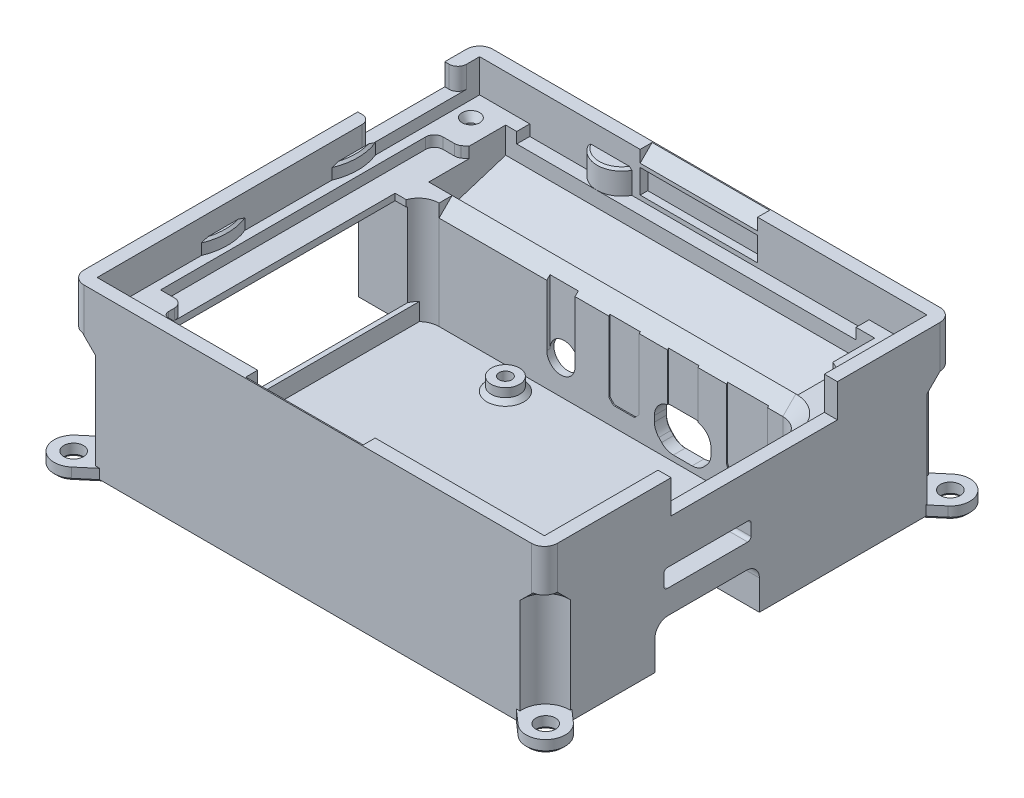
from build123d import *
from OCP.BRepFilletAPI import BRepFilletAPI_MakeChamfer

# Parameters (mm, degrees)
SKETCH1_W                          = 108.81
SKETCH1_H                          = 93.91
BOSS_EXTRUDE1_DEPTH                = 3
SKETCH2_W                          = 108.81
SKETCH2_H                          = 93.91
SKETCH2_W_2                        = 102.81
SKETCH2_H_2                        = 87.91
BOSS_EXTRUDE2_DEPTH                = 34.7
SKETCH3_W                          = 102.81
SKETCH3_H                          = 67.235
BOSS_EXTRUDE3_DEPTH                = 27.09
SKETCH4_R                          = 3.25
CUT_EXTRUDE1_DEPTH                 = 4.75
CUT_EXTRUDE2_DEPTH                 = 0.5
CUT_EXTRUDE2_DEPTH_BACK            = 1
SKETCH6_W                          = 9
SKETCH6_H                          = 20.675
BOSS_EXTRUDE4_DEPTH                = 27.09
SKETCH8_W                          = 84.81
SKETCH8_H                          = 20.675
BOSS_EXTRUDE5_DEPTH                = 6
SKETCH9_W                          = 84.81
SKETCH9_H                          = 24.09
CUT_EXTRUDE4_DEPTH                 = 23.675
SKETCH11_W                         = 18.87
SKETCH11_H                         = 15.3
SKETCH11_W_2                       = 18.86
SKETCH11_H_2                       = 15.1
CUT_EXTRUDE6_DEPTH                 = 81.489602124
SKETCH10_W                         = 57.35
SKETCH10_H                         = 26.1
CUT_EXTRUDE5_DEPTH                 = 13
CUT_EXTRUDE7_REACH                 = 96.383
CUT_EXTRUDE8_DEPTH                 = 1
CUT_EXTRUDE8_DEPTH_BACK            = 1
SKETCH12_3_R                       = 5.75
CUT_EXTRUDE9_DEPTH                 = 1.35
CHAMFER1_SIZE                      = 0.25
SKETCH14_W                         = 1.75
SKETCH14_H                         = 5
CUT_EXTRUDE10_DEPTH                = 13.5
SKETCH15_W                         = 38.225000066
SKETCH15_H                         = 7.61
CUT_EXTRUDE11_DEPTH                = 3
SKETCH16_W                         = 24.345
SKETCH16_H                         = 24
CUT_EXTRUDE12_DEPTH                = 10.6
SKETCH17_W                         = 20
SKETCH17_H                         = 4.16
CUT_EXTRUDE13_DEPTH                = 7.695
BOSS_EXTRUDE6_DEPTH                = 3
SKETCH19_R                         = 5.5
CUT_EXTRUDE14_DEPTH                = 25
F_8_CLEARANCE_HOLE1_D              = 4.4958
F_8_CLEARANCE_HOLE1_DEPTH          = 3
SKETCH49_R                         = 2
BOSS_EXTRUDE11_DEPTH               = 10
TAP_DRILL_FOR_M2_5X0_45_TAP1_D     = 2.05
TAP_DRILL_FOR_M2_5X0_45_TAP1_DEPTH = 10
TAP_DRILL_FOR_M2_5X0_45_TAP1_TIP   = 0.615882135
CHAMFER2_SIZE                      = 3
SKETCH28_W                         = 3
SKETCH28_H                         = 20
CUT_EXTRUDE16_DEPTH                = 5
FILLET1_R                          = 2
CUT_EXTRUDE17_DEPTH                = 2.15
SKETCH30_R                         = 3.25
BOSS_EXTRUDE7_DEPTH                = 3
M2_5_CLEARANCE_HOLE2_D             = 2.9
CUT_EXTRUDE20_DEPTH                = 2.5
SKETCH39_W                         = 2.54578851
SKETCH39_H                         = 52.15
CUT_EXTRUDE21_DEPTH                = 1.49
BOSS_EXTRUDE8_DEPTH                = 3
BOSS_EXTRUDE8_DIRECTION_2_REACH    = 86.122
CHAMFER3_SIZE                      = 0.5
CHAMFER4_SIZE                      = 3
SKETCH44_W                         = 5.21
SKETCH44_H                         = 62.918665607
CUT_EXTRUDE23_DEPTH                = 2.5
FILLET2_R                          = 2
FILLET3_R                          = 3
SKETCH45_W                         = 1.115
SKETCH45_H                         = 59.5
BOSS_EXTRUDE9_DEPTH                = 4
FILLET4_R                          = 3
CHAMFER8_SIZE                      = 1
FILLET5_R                          = 3
FILLET6_R                          = 0.75
CHAMFER6_SIZE                      = 0.75
CHAMFER10_SIZE                     = 0.5
CUT_EXTRUDE24_DEPTH                = 83.166846112
CUT_EXTRUDE24_DEPTH_BACK           = 83.166846112
SKETCH46_W                         = 84.81
SKETCH46_H                         = 17.675
BOSS_EXTRUDE10_DEPTH               = 84.81
CHAMFER11_SIZE                     = 1
CHAMFER11_SIZE2                    = 1.732050808
CHAMFER12_SIZE                     = 1
CHAMFER12_SIZE2                    = 1.732050808


with BuildPart() as part:
    # Sketch1 → Boss-Extrude1 (new body)
    with BuildSketch(Plane(origin=(0, -30.09, 0), x_dir=(-1, 0, 0), z_dir=(0, -1, 0))):
        with Locations((-1, 0)):
            Rectangle(SKETCH1_W, SKETCH1_H)
    extrude(amount=-BOSS_EXTRUDE1_DEPTH)

    # Sketch2 → Boss-Extrude2 (add)
    with BuildSketch(Plane(origin=(0, -27.09, 0), x_dir=(1, 0, 0), z_dir=(0, 1, 0))):
        with Locations((1, 0)):
            Rectangle(SKETCH2_W, SKETCH2_H)
        with Locations((1, 0)):
            Rectangle(SKETCH2_W_2, SKETCH2_H_2, mode=Mode.SUBTRACT)
    extrude(amount=BOSS_EXTRUDE2_DEPTH)

    # Sketch3 → Boss-Extrude3 (add)
    with BuildSketch(Plane(origin=(0, -27.09, 0), x_dir=(1, 0, 0), z_dir=(0, 1, 0))):
        with Locations((1, -10.3375)):
            Rectangle(SKETCH3_W, SKETCH3_H)
        with BuildLine():
            Line((47.71, -34.47), (47.71, 15.53))
            ThreePointArc((47.71, 15.53), (46.318757211, 18.888757211), (42.96, 20.28))
            Line((42.96, 20.28), (-36.04, 20.28))
            ThreePointArc((-36.04, 20.28), (-39.398757211, 18.888757211), (-40.79, 15.53))
            Line((-40.79, 15.53), (-40.79, -34.47))
            ThreePointArc((-40.79, -34.47), (-39.398757211, -37.828757211), (-36.04, -39.22))
            Line((-36.04, -39.22), (42.96, -39.22))
            ThreePointArc((42.96, -39.22), (46.318757211, -37.828757211), (47.71, -34.47))
        make_face(mode=Mode.SUBTRACT)
    extrude(amount=BOSS_EXTRUDE3_DEPTH)

    # Sketch4 → Cut-Extrude1 (cut)
    with BuildSketch(Plane(origin=(0, 0, -18.53), x_dir=(-1, 0, 0), z_dir=(0, 0, -1))):
        with Locations(Location((8.04, -19.49, 0), (0, 0, 180))):
            Circle(SKETCH4_R)
        with BuildLine():
            Line((-23.267993486, -21.841802043), (-22.623505714, -22.521604214))
            ThreePointArc((-22.623505714, -22.521604214), (-22.391987408, -22.683087455), (-22.115512228, -22.74))
            Line((-22.115512228, -22.74), (-20.120000109, -22.74))
            Line((-20.120000109, -22.74), (-19.800000109, -22.74))
            Line((-19.800000109, -22.74), (-17.804487772, -22.74))
            ThreePointArc((-17.804487772, -22.74), (-17.528012592, -22.683087455), (-17.296494286, -22.521604214))
            Line((-17.296494286, -22.521604214), (-16.652006514, -21.841802043))
            ThreePointArc((-16.652006514, -21.841802043), (-16.509771025, -21.619431855), (-16.46, -21.36019783))
            Line((-16.46, -21.36019783), (-16.46, -20.04))
            ThreePointArc((-16.46, -20.04), (-16.665025253, -19.545025253), (-17.16, -19.34))
            Line((-17.16, -19.34), (-22.76, -19.34))
            ThreePointArc((-22.76, -19.34), (-23.254974747, -19.545025253), (-23.46, -20.04))
            Line((-23.46, -20.04), (-23.46, -21.36019783))
            ThreePointArc((-23.46, -21.36019783), (-23.410228975, -21.619431855), (-23.267993486, -21.841802043))
        make_face()
    extrude(amount=CUT_EXTRUDE1_DEPTH, mode=Mode.SUBTRACT)

    # Sketch5 → Cut-Extrude2 (cut, two sides: drawn at the far end of the back side and taken through both)
    with BuildSketch(Plane(origin=(0, 0, -20.030000004), x_dir=(-1, 0, 0), z_dir=(0, 0, -1)).offset(-CUT_EXTRUDE2_DEPTH_BACK)):
        with BuildLine():
            Line((-39.48, -20.63), (-39.48, 0))
            Line((-39.48, 0), (-30.04, 0))
            Line((-30.04, 0), (-30.04, -20.63))
            Line((-30.04, -20.63), (-30.04, -21.19))
            ThreePointArc((-30.04, -21.19), (-30.493984489, -22.286015511), (-31.59, -22.74))
            Line((-31.59, -22.74), (-37.93, -22.74))
            ThreePointArc((-37.93, -22.74), (-39.026015511, -22.286015511), (-39.48, -21.19))
            Line((-39.48, -21.19), (-39.48, -20.63))
        make_face()
        with BuildLine():
            Line((-23.46, -20.04), (-23.46, 0))
            Line((-23.46, 0), (-16.46, 0))
            Line((-16.46, 0), (-16.46, -20.04))
            Line((-16.46, -20.04), (-16.46, -21.36019783))
            ThreePointArc((-16.46, -21.36019783), (-16.509771025, -21.619431855), (-16.652006514, -21.841802043))
            Line((-16.652006514, -21.841802043), (-17.296494286, -22.521604214))
            ThreePointArc((-17.296494286, -22.521604214), (-17.528012592, -22.683087455), (-17.804487772, -22.74))
            Line((-17.804487772, -22.74), (-19.800000109, -22.74))
            Line((-19.800000109, -22.74), (-20.120000109, -22.74))
            Line((-20.120000109, -22.74), (-22.115512228, -22.74))
            ThreePointArc((-22.115512228, -22.74), (-22.391987408, -22.683087455), (-22.623505714, -22.521604214))
            Line((-22.623505714, -22.521604214), (-23.267993486, -21.841802043))
            ThreePointArc((-23.267993486, -21.841802043), (-23.410228975, -21.619431855), (-23.46, -21.36019783))
            Line((-23.46, -21.36019783), (-23.46, -20.04))
        make_face()
        with BuildLine():
            Line((-6.300000109, -22.74), (-4.304487772, -22.74))
            ThreePointArc((-4.304487772, -22.74), (-4.028012592, -22.683087455), (-3.796494286, -22.521604214))
            Line((-3.796494286, -22.521604214), (-3.152006514, -21.841802043))
            ThreePointArc((-3.152006514, -21.841802043), (-3.009771025, -21.619431855), (-2.96, -21.36019783))
            Line((-2.96, -21.36019783), (-2.96, -20.04))
            Line((-2.96, -20.04), (-2.96, 0))
            Line((-2.96, 0), (-9.96, 0))
            Line((-9.96, 0), (-9.96, -20.04))
            Line((-9.96, -20.04), (-9.96, -21.36019783))
            ThreePointArc((-9.96, -21.36019783), (-9.910228975, -21.619431855), (-9.767993486, -21.841802043))
            Line((-9.767993486, -21.841802043), (-9.123505714, -22.521604214))
            ThreePointArc((-9.123505714, -22.521604214), (-8.891987408, -22.683087455), (-8.615512228, -22.74))
            Line((-8.615512228, -22.74), (-6.620000109, -22.74))
            Line((-6.620000109, -22.74), (-6.300000109, -22.74))
        make_face()
    extrude(amount=CUT_EXTRUDE2_DEPTH + CUT_EXTRUDE2_DEPTH_BACK, mode=Mode.SUBTRACT)

    # Sketch6 → Boss-Extrude4 (add)
    with BuildSketch(Plane(origin=(0, -27.09, 0), x_dir=(1, 0, 0), z_dir=(0, 1, 0))):
        with Locations((47.905, 33.6175)):
            Rectangle(SKETCH6_W, SKETCH6_H)
        with Locations((-45.905, 33.6175)):
            Rectangle(SKETCH6_W, SKETCH6_H)
    extrude(amount=BOSS_EXTRUDE4_DEPTH)

    # Sketch8 → Boss-Extrude5 (add)
    with BuildSketch(Plane(origin=(0, 0, 0), x_dir=(1, 0, 0), z_dir=(0, 1, 0))):
        with Locations((1, 33.6175)):
            Rectangle(SKETCH8_W, SKETCH8_H)
    extrude(amount=-BOSS_EXTRUDE5_DEPTH)

    # Sketch9 → Cut-Extrude4 (cut)
    with BuildSketch(Plane(origin=(0, 0, -46.955), x_dir=(-1, 0, 0), z_dir=(0, 0, -1))):
        with Locations((-1, -18.045)):
            Rectangle(SKETCH9_W, SKETCH9_H)
    extrude(amount=-CUT_EXTRUDE4_DEPTH, mode=Mode.SUBTRACT)

    # Sketch11 → Cut-Extrude6 (cut, through all)
    with BuildSketch(Plane.XZ.offset(27.09)):
        with Locations((-33.605, -9.53)):
            Rectangle(SKETCH11_W, SKETCH11_H)
        with Locations((-33.61, 8.47)):
            Rectangle(SKETCH11_W_2, SKETCH11_H_2)
        with BuildLine():
            Line((-19.69, 19.47), (-19.69, 34.97))
            ThreePointArc((-19.69, 34.97), (-20.041471863, 35.818528137), (-20.89, 36.17))
            Line((-20.89, 36.17), (-41.84, 36.17))
            ThreePointArc((-41.84, 36.17), (-42.688528137, 35.818528137), (-43.04, 34.97))
            Line((-43.04, 34.97), (-43.04, 19.47))
            ThreePointArc((-43.04, 19.47), (-42.688528137, 18.621471863), (-41.84, 18.27))
            Line((-41.84, 18.27), (-20.89, 18.27))
            ThreePointArc((-20.89, 18.27), (-20.041471863, 18.621471863), (-19.69, 19.47))
        make_face()
    extrude(amount=-CUT_EXTRUDE6_DEPTH, mode=Mode.SUBTRACT)

    # Sketch10 → Cut-Extrude5 (cut)
    with BuildSketch(Plane.ZY.offset(53.405)):
        with Locations((9.495, -17.04)):
            Rectangle(SKETCH10_W, SKETCH10_H)
    extrude(amount=-CUT_EXTRUDE5_DEPTH, mode=Mode.SUBTRACT)

    # Sketch12 → Cut-Extrude7 (cut, up to next)
    with BuildSketch(Plane(origin=(0, 0, -23.28), x_dir=(-1, 0, 0), z_dir=(0, 0, -1)), mode=Mode.PRIVATE) as cut_extrude7_sk1:
        with BuildLine():
            Line((-17.16, -16.34), (-22.76, -16.34))
            ThreePointArc((-22.76, -16.34), (-25.37629509, -17.42370491), (-26.46, -20.04))
            Line((-26.46, -20.04), (-26.46, -21.36019783))
            ThreePointArc((-26.46, -21.36019783), (-26.196924582, -22.730434822), (-25.445108424, -23.905820102))
            Line((-25.445108424, -23.905820102), (-24.800620652, -24.585622272))
            ThreePointArc((-24.800620652, -24.585622272), (-23.576881038, -25.439176548), (-22.115512228, -25.74))
            Line((-22.115512228, -25.74), (-20.120000109, -25.74))
            Line((-20.120000109, -25.74), (-19.800000109, -25.74))
            Line((-19.800000109, -25.74), (-17.804487772, -25.74))
            ThreePointArc((-17.804487772, -25.74), (-16.343118962, -25.439176548), (-15.119379348, -24.585622272))
            Line((-15.119379348, -24.585622272), (-14.474891576, -23.905820102))
            ThreePointArc((-14.474891576, -23.905820102), (-13.723075418, -22.730434822), (-13.46, -21.36019783))
            Line((-13.46, -21.36019783), (-13.46, -20.04))
            ThreePointArc((-13.46, -20.04), (-14.54370491, -17.42370491), (-17.16, -16.34))
        make_face()
    cut_extrude7_tool1 = extrude(cut_extrude7_sk1.sketch, amount=-CUT_EXTRUDE7_REACH, mode=Mode.PRIVATE) & part.part
    add(cut_extrude7_tool1.solids().sort_by_distance((19.96, -20.938134, -23.28))[0], mode=Mode.SUBTRACT)

    # Sketch5<3> → Cut-Extrude8 (cut, two sides: drawn at the far end of the back side and taken through both)
    with BuildSketch(Plane(origin=(0, 0, -20.030000004), x_dir=(-1, 0, 0), z_dir=(0, 0, -1)).offset(-CUT_EXTRUDE8_DEPTH_BACK)):
        with BuildLine():
            Line((4.79, -19.49), (4.79, 0))
            Line((4.79, 0), (11.29, 0))
            Line((11.29, 0), (11.29, -19.49))
            ThreePointArc((11.29, -19.49), (8.04, -22.74), (4.79, -19.49))
        make_face()
    extrude(amount=CUT_EXTRUDE8_DEPTH + CUT_EXTRUDE8_DEPTH_BACK, mode=Mode.SUBTRACT)

    # Sketch12<3> → Cut-Extrude9 (cut)
    with BuildSketch(Plane(origin=(0, 0, -23.28), x_dir=(-1, 0, 0), z_dir=(0, 0, -1))):
        with Locations(Location((8.04, -19.49, 0), (0, 0, 90))):
            Circle(SKETCH12_3_R)
    extrude(amount=-CUT_EXTRUDE9_DEPTH, mode=Mode.SUBTRACT)

    # Chamfer1
    chamfer1_edges = [part.edges().sort_by_distance(p)[0] for p in [
        (19.96, -25.74, -23.28),
        (16.343118962, -25.439176548, -23.28),
        (14.797135462, -24.245721187, -23.28),
        (13.723075418, -22.730434822, -23.28),
        (13.46, -20.700098915, -23.28),
        (14.54370491, -17.42370491, -23.28),
        (19.96, -16.34, -23.28),
        (25.37629509, -17.42370491, -23.28),
        (26.46, -20.700098915, -23.28),
        (26.196924582, -22.730434822, -23.28),
        (25.122864538, -24.245721187, -23.28),
        (23.576881038, -25.439176548, -23.28),
        (-8.04, -25.24, -23.28),
    ]]
    chamfer(chamfer1_edges, length=CHAMFER1_SIZE)

    # Sketch14 → Cut-Extrude10 (cut, symmetric)
    with BuildSketch(Plane.ZY):
        with Locations((-44.83, 1.01)):
            Rectangle(SKETCH14_W, SKETCH14_H)
        Polygon((-46.705, 7.61), (-43.955, 7.61), (-43.955, 4.86), align=None)
    cut_extrude10 = extrude(amount=CUT_EXTRUDE10_DEPTH, both=True, mode=Mode.SUBTRACT)

    # Mirror1: Cut-Extrude10 across plane
    add(cut_extrude10.mirror(Plane.XY), mode=Mode.SUBTRACT)

    # Sketch15 → Cut-Extrude11 (cut)
    with BuildSketch(Plane(origin=(55.405, 0, 0), x_dir=(0, 0, -1), z_dir=(1, 0, 0))):
        with Locations((1.2725, 3.805)):
            Rectangle(SKETCH15_W, SKETCH15_H)
    extrude(amount=-CUT_EXTRUDE11_DEPTH, mode=Mode.SUBTRACT)

    # Sketch16 → Cut-Extrude12 (cut)
    with BuildSketch(Plane.XZ.offset(30.09)):
        with Locations((43.2325, 9.545)):
            Rectangle(SKETCH16_W, SKETCH16_H)
    extrude(amount=-CUT_EXTRUDE12_DEPTH, mode=Mode.SUBTRACT)

    # Sketch17 → Cut-Extrude13 (cut)
    with BuildSketch(Plane(origin=(55.405, 0, 0), x_dir=(0, 0, -1), z_dir=(1, 0, 0))):
        with Locations((-9.47, -11.93)):
            Rectangle(SKETCH17_W, SKETCH17_H)
    extrude(amount=-CUT_EXTRUDE13_DEPTH, mode=Mode.SUBTRACT)

    # Sketch18 → Boss-Extrude6 (add)
    with BuildSketch(Plane.XZ.offset(30.09)):
        with BuildLine():
            Line((-56.221348787, -43.120490215), (-53.405, -40.64428654))
            Line((-53.405, -40.64428654), (-53.405, -46.955))
            Line((-53.405, -46.955), (-46.952414496, -46.955))
            Line((-46.952414496, -46.955), (-50.278651213, -49.879509785))
            ThreePointArc((-50.278651213, -49.879509785), (-56.629509785, -49.471348787), (-56.221348787, -43.120490215))
        make_face()
        with BuildLine():
            Line((-56.159405695, 43.067019007), (-53.405, 40.732696844))
            Line((-53.405, 40.732696844), (-53.405, 46.955))
            Line((-53.405, 46.955), (-46.826697234, 46.955))
            Line((-46.826697234, 46.955), (-50.340594305, 49.932980993))
            ThreePointArc((-50.340594305, 49.932980993), (-56.682980993, 49.409405695), (-56.159405695, 43.067019007))
        make_face()
        with BuildLine():
            Line((48.952414496, 46.955), (52.278651213, 49.879509785))
            ThreePointArc((52.278651213, 49.879509785), (58.629509785, 49.471348787), (58.221348787, 43.120490215))
            Line((58.221348787, 43.120490215), (55.405, 40.64428654))
            Line((55.405, 40.64428654), (55.405, 46.955))
            Line((55.405, 46.955), (48.952414496, 46.955))
        make_face()
        with BuildLine():
            Line((52.340594305, -49.932980993), (48.826697234, -46.955))
            Line((48.826697234, -46.955), (55.405, -46.955))
            Line((55.405, -46.955), (55.405, -40.732696844))
            Line((55.405, -40.732696844), (58.159405695, -43.067019007))
            ThreePointArc((58.159405695, -43.067019007), (58.682980993, -49.409405695), (52.340594305, -49.932980993))
        make_face()
    extrude(amount=-BOSS_EXTRUDE6_DEPTH)

    # Sketch19 → Cut-Extrude14 (cut)
    with BuildSketch(Plane(origin=(0, -27.09, 0), x_dir=(1, 0, 0), z_dir=(0, 1, 0))):
        with Locations((55.25, -46.5)):
            Circle(SKETCH19_R)
        with Locations((-53.25, -46.5)):
            Circle(SKETCH19_R)
        with Locations((-53.25, 46.5)):
            Circle(SKETCH19_R)
        with Locations((55.25, 46.5)):
            Circle(SKETCH19_R)
    extrude(amount=CUT_EXTRUDE14_DEPTH, mode=Mode.SUBTRACT)

    # #8 Clearance Hole1
    with Locations(Plane(origin=(0, -27.09, 0), x_dir=(1, 0, 0), z_dir=(0, 1, 0))):
        with Locations((55.25, -46.5), (55.25, 46.5), (-53.25, -46.5), (-53.25, 46.5)):
            Hole(F_8_CLEARANCE_HOLE1_D / 2, depth=F_8_CLEARANCE_HOLE1_DEPTH)

    # Sketch49 → Boss-Extrude11 (add)
    with BuildSketch(Plane.XZ.offset(3.99)):
        with Locations((-46.865, 38.415)):
            Circle(SKETCH49_R)
    extrude(amount=BOSS_EXTRUDE11_DEPTH)

    # Tap Drill for M2.5x0.45 Tap1
    with Locations(Plane(origin=(0, 0, 0), x_dir=(1, 0, 0), z_dir=(0, 1, 0))):
        with Locations((47.115, -38.415), (-46.865, -38.415), (-46.865, 38.42), (47.115, 38.42)):
            Hole(TAP_DRILL_FOR_M2_5X0_45_TAP1_D / 2, depth=TAP_DRILL_FOR_M2_5X0_45_TAP1_DEPTH)
            with Locations((0, 0, -(TAP_DRILL_FOR_M2_5X0_45_TAP1_DEPTH + TAP_DRILL_FOR_M2_5X0_45_TAP1_TIP / 2))):  # 118° drill point
                Cone(0, TAP_DRILL_FOR_M2_5X0_45_TAP1_D / 2, TAP_DRILL_FOR_M2_5X0_45_TAP1_TIP, mode=Mode.SUBTRACT)

    # Chamfer2
    chamfer2_edges = [part.edges().sort_by_distance(p)[0] for p in [
        (51.25613419, -2.09, -42.718593398),
        (-49.25613419, -2.09, -42.718593398),
        (-49.25613419, -2.09, 42.718593398),
        (51.25613419, -2.09, 42.718593398),
    ]]
    chamfer(chamfer2_edges, length=CHAMFER2_SIZE)

    # Sketch28 → Cut-Extrude16 (cut)
    with BuildSketch(Plane(origin=(0, 7.61, 0), x_dir=(1, 0, 0), z_dir=(0, 1, 0))):
        with Locations((-51.905, 28.955)):
            Rectangle(SKETCH28_W, SKETCH28_H)
    extrude(amount=-CUT_EXTRUDE16_DEPTH, mode=Mode.SUBTRACT)

    # Fillet1
    fillet1_edges = [part.edges().sort_by_distance(p)[0] for p in [
        (-50.405, 5.11, -38.955),
        (-50.405, 5.11, -18.955),
    ]]
    fillet(fillet1_edges, radius=FILLET1_R)

    # Sketch29 → Cut-Extrude17 (cut)
    with BuildSketch(Plane.XZ.offset(30.09)):
        Polygon((43.989978213, 36.62), (40.930021787, 36.62), (39.400043573, 33.97), (40.930021787, 31.32), (43.989978213, 31.32), (45.519956427, 33.97), align=None)
        Polygon((-14.010021787, 36.62), (-17.069978213, 36.62), (-18.599956427, 33.97), (-17.069978213, 31.32), (-14.010021787, 31.32), (-12.480043573, 33.97), align=None)
        Polygon((-14.010021787, -12.38), (-17.069978213, -12.38), (-18.599956427, -15.03), (-17.069978213, -17.68), (-14.010021787, -17.68), (-12.480043573, -15.03), align=None)
        Polygon((43.989978213, -12.38), (40.930021787, -12.38), (39.400043573, -15.03), (40.930021787, -17.68), (43.989978213, -17.68), (45.519956427, -15.03), align=None)
    extrude(amount=-CUT_EXTRUDE17_DEPTH, mode=Mode.SUBTRACT)

    # Sketch30 → Boss-Extrude7 (add)
    with BuildSketch(Plane(origin=(0, -27.09, 0), x_dir=(1, 0, 0), z_dir=(0, 1, 0))):
        with Locations(Location((-15.54, -33.97, 0), (0, 0, 90))):
            Circle(SKETCH30_R)
        with Locations(Location((42.46, -33.97, 0), (0, 0, 90))):
            Circle(SKETCH30_R)
        with Locations(Location((42.46, 15.03, 0), (0, 0, 90))):
            Circle(SKETCH30_R)
        with Locations(Location((-15.54, 15.03, 0), (0, 0, 90))):
            Circle(SKETCH30_R)
    extrude(amount=BOSS_EXTRUDE7_DEPTH)

    # M2.5 Clearance Hole2 (through all)
    with Locations(Plane(origin=(0, -24.09, 0), x_dir=(1, 0, 0), z_dir=(0, 1, 0))):
        with Locations((-15.54, 15.03), (42.46, 15.03), (42.46, -33.97), (-15.54, -33.97)):
            Hole(M2_5_CLEARANCE_HOLE2_D / 2)

    # Sketch38 → Cut-Extrude20 (cut)
    with BuildSketch(Plane(origin=(0, 0, 0), x_dir=(1, 0, 0), z_dir=(0, 1, 0))):
        with BuildLine():
            Line((52.405, 30.42), (52.405, -30.415))
            Line((52.405, -30.415), (47.115, -30.415))
            ThreePointArc((47.115, -30.415), (41.458145751, -32.758145751), (39.115, -38.415))
            Line((39.115, -38.415), (39.115, -43.955))
            Line((39.115, -43.955), (-38.865, -43.955))
            Line((-38.865, -43.955), (-38.865, -30.415))
            ThreePointArc((-38.865, -30.415), (-39.987500454, -26.328436652), (-43.04, -23.388665607))
            Line((-43.04, -23.388665607), (-43.04, 31.393665607))
            ThreePointArc((-43.04, 31.393665607), (-39.987500454, 34.333436652), (-38.865, 38.42))
            Line((-38.865, 38.42), (-38.865, 43.955))
            Line((-38.865, 43.955), (39.115, 43.955))
            Line((39.115, 43.955), (39.115, 38.42))
            ThreePointArc((39.115, 38.42), (41.458145751, 32.763145751), (47.115, 30.42))
            Line((47.115, 30.42), (52.405, 30.42))
        make_face()
    extrude(amount=-CUT_EXTRUDE20_DEPTH, mode=Mode.SUBTRACT)

    # Sketch39 → Cut-Extrude21 (cut)
    with BuildSketch(Plane(origin=(0, -2.5, 0), x_dir=(1, 0, 0), z_dir=(0, 1, 0))):
        with Locations((-41.767105745, -8.895)):
            Rectangle(SKETCH39_W, SKETCH39_H)
    extrude(amount=-CUT_EXTRUDE21_DEPTH, mode=Mode.SUBTRACT)

    # Sketch36 → Boss-Extrude8 (add)
    with BuildSketch(Plane(origin=(0, 0, 0), x_dir=(1, 0, 0), z_dir=(0, 1, 0))):
        with BuildLine():
            Line((-15.405, 43.955), (-25.405, 43.955))
            ThreePointArc((-25.405, 43.955), (-20.405, 40.955), (-15.405, 43.955))
        make_face()
        with BuildLine():
            Line((-15.405, -43.955), (-25.405, -43.955))
            ThreePointArc((-25.405, -43.955), (-20.405, -40.955), (-15.405, -43.955))
        make_face()
        with BuildLine():
            Line((-50.405, 20), (-50.405, 10))
            ThreePointArc((-50.405, 10), (-49.405, 15), (-50.405, 20))
        make_face()
        with BuildLine():
            Line((-50.405, -20), (-50.405, -10))
            ThreePointArc((-50.405, -10), (-49.405, -15), (-50.405, -20))
        make_face()
    extrude(amount=BOSS_EXTRUDE8_DEPTH)

    # Boss-Extrude8 direction 2: up to this face of the body (flat: up to its plane)
    boss_extrude8_direction_2_end = Plane(part.part.faces().sort_by_distance((7.104715638, -2.5, -27.697617001))[0])
    # Sketch36 → Boss-Extrude8 direction 2 (add, up to the picked face)
    with BuildSketch(Plane(origin=(0, 0, 0), x_dir=(1, 0, 0), z_dir=(0, 1, 0)), mode=Mode.PRIVATE) as boss_extrude8_direction_2_sk1:
        with BuildLine():
            Line((-15.405, 43.955), (-25.405, 43.955))
            ThreePointArc((-25.405, 43.955), (-20.405, 40.955), (-15.405, 43.955))
        make_face()
    boss_extrude8_direction_2_tool1 = split(extrude(boss_extrude8_direction_2_sk1.sketch, amount=-BOSS_EXTRUDE8_DIRECTION_2_REACH, mode=Mode.PRIVATE), bisect_by=boss_extrude8_direction_2_end, keep=Keep.BOTH, mode=Mode.PRIVATE)
    # Sketch36 → Boss-Extrude8 direction 2 (add, up to the picked face)
    with BuildSketch(Plane(origin=(0, 0, 0), x_dir=(1, 0, 0), z_dir=(0, 1, 0)), mode=Mode.PRIVATE) as boss_extrude8_direction_2_sk2:
        with BuildLine():
            Line((-15.405, -43.955), (-25.405, -43.955))
            ThreePointArc((-25.405, -43.955), (-20.405, -40.955), (-15.405, -43.955))
        make_face()
    boss_extrude8_direction_2_tool2 = split(extrude(boss_extrude8_direction_2_sk2.sketch, amount=-BOSS_EXTRUDE8_DIRECTION_2_REACH, mode=Mode.PRIVATE), bisect_by=boss_extrude8_direction_2_end, keep=Keep.BOTH, mode=Mode.PRIVATE)
    # Sketch36 → Boss-Extrude8 direction 2 (add, up to the picked face)
    with BuildSketch(Plane(origin=(0, 0, 0), x_dir=(1, 0, 0), z_dir=(0, 1, 0)), mode=Mode.PRIVATE) as boss_extrude8_direction_2_sk3:
        with BuildLine():
            Line((-50.405, 20), (-50.405, 10))
            ThreePointArc((-50.405, 10), (-49.405, 15), (-50.405, 20))
        make_face()
    boss_extrude8_direction_2_tool3 = split(extrude(boss_extrude8_direction_2_sk3.sketch, amount=-BOSS_EXTRUDE8_DIRECTION_2_REACH, mode=Mode.PRIVATE), bisect_by=boss_extrude8_direction_2_end, keep=Keep.BOTH, mode=Mode.PRIVATE)
    # Sketch36 → Boss-Extrude8 direction 2 (add, up to the picked face)
    with BuildSketch(Plane(origin=(0, 0, 0), x_dir=(1, 0, 0), z_dir=(0, 1, 0)), mode=Mode.PRIVATE) as boss_extrude8_direction_2_sk4:
        with BuildLine():
            Line((-50.405, -20), (-50.405, -10))
            ThreePointArc((-50.405, -10), (-49.405, -15), (-50.405, -20))
        make_face()
    boss_extrude8_direction_2_tool4 = split(extrude(boss_extrude8_direction_2_sk4.sketch, amount=-BOSS_EXTRUDE8_DIRECTION_2_REACH, mode=Mode.PRIVATE), bisect_by=boss_extrude8_direction_2_end, keep=Keep.BOTH, mode=Mode.PRIVATE)
    add(boss_extrude8_direction_2_tool1.solids().sort_by(Axis((-20.405, 0, -42.722777), (0, -1, 0)))[0])
    add(boss_extrude8_direction_2_tool2.solids().sort_by(Axis((-20.405, 0, 42.722777), (0, -1, 0)))[0])
    add(boss_extrude8_direction_2_tool3.solids().sort_by(Axis((-50.003651, 0, -15), (0, -1, 0)))[0])
    add(boss_extrude8_direction_2_tool4.solids().sort_by(Axis((-50.003651, 0, 15), (0, -1, 0)))[0])

    # Chamfer3
    # the kernel refuses this chamfer: 0.5 mm, written as the material it takes off along each edge
    with BuildSketch(Plane(origin=(-20.405, 3, -46.621666667), x_dir=(-0.9656478012877098, 0, 0.2598544282251347), z_dir=(-0.2598544282251347, 0, -0.9656478012877098))) as chamfer3_piece_1_section:
        Polygon((5.666666667, -CHAMFER3_SIZE), (5.666666667 - CHAMFER3_SIZE, 0), (5.666666667, 0), align=None)
    chamfer3_piece_1 = revolve(axis=Axis((-20.405, 3, -46.621666667), (0, 1, 0)), revolution_arc=149.877150782, mode=Mode.PRIVATE)
    chamfer3_piece_1 = split(chamfer3_piece_1, bisect_by=Plane(origin=(-20.405, 2.758028668, -43.955), z_dir=(0, 0, 1)), keep=Keep.TOP, mode=Mode.PRIVATE)
    add(chamfer3_piece_1, mode=Mode.SUBTRACT)
    with BuildSketch(Plane(origin=(-20.405, 3, 46.621666667), x_dir=(-0.9656478012877098, 0, -0.2598544282251347), z_dir=(-0.2598544282251347, 0, 0.9656478012877098))) as chamfer3_piece_2_section:
        Polygon((5.666666667, CHAMFER3_SIZE), (5.666666667 - CHAMFER3_SIZE, 0), (5.666666667, 0), align=None)
    chamfer3_piece_2 = revolve(axis=Axis((-20.405, 3, 46.621666667), (0, -1, 0)), revolution_arc=149.877150782, mode=Mode.PRIVATE)
    chamfer3_piece_2 = split(chamfer3_piece_2, bisect_by=Plane(origin=(-20.405, 2.758028668, 43.955), z_dir=(0, 0, -1)), keep=Keep.TOP, mode=Mode.PRIVATE)
    add(chamfer3_piece_2, mode=Mode.SUBTRACT)
    with BuildSketch(Plane(origin=(-62.405, 3, -15), x_dir=(0.8805798010054622, 0, 0.47389789413035005), z_dir=(-0.47389789413035005, 0, 0.8805798010054622))) as chamfer3_piece_3_section:
        Polygon((13, -CHAMFER3_SIZE), (13 - CHAMFER3_SIZE, 0), (13, 0), align=None)
    chamfer3_piece_3 = revolve(axis=Axis((-62.405, 3, -15), (0, 1, 0)), revolution_arc=56.57523251, mode=Mode.PRIVATE)
    chamfer3_piece_3 = split(chamfer3_piece_3, bisect_by=Plane(origin=(-50.405, 2.557781198, -15), z_dir=(1, 0, 0)), keep=Keep.TOP, mode=Mode.PRIVATE)
    add(chamfer3_piece_3, mode=Mode.SUBTRACT)
    with BuildSketch(Plane(origin=(-62.405, 3, 15), x_dir=(0.8805798010054622, 0, -0.47389789413035005), z_dir=(-0.47389789413035005, 0, -0.8805798010054622))) as chamfer3_piece_4_section:
        Polygon((13, CHAMFER3_SIZE), (13 - CHAMFER3_SIZE, 0), (13, 0), align=None)
    chamfer3_piece_4 = revolve(axis=Axis((-62.405, 3, 15), (0, -1, 0)), revolution_arc=56.57523251, mode=Mode.PRIVATE)
    chamfer3_piece_4 = split(chamfer3_piece_4, bisect_by=Plane(origin=(-50.405, 2.757429512, 15), z_dir=(1, 0, 0)), keep=Keep.TOP, mode=Mode.PRIVATE)
    add(chamfer3_piece_4, mode=Mode.SUBTRACT)

    # Cut-Sweep2: sweep along a path in Sketch41
    with BuildLine(Plane(origin=(0, -2.5, 0), x_dir=(1, 0, 0), z_dir=(0, 1, 0))) as cut_sweep2_path:
        Line((47.71, -30.415), (47.71, 15.53))
        ThreePointArc((47.71, 15.53), (46.318757211, 18.888757211), (42.96, 20.28))
        Line((42.96, 20.28), (-36.04, 20.28))
    # Sketch40 → Cut-Sweep2 (sweep, cut)
    with BuildSketch(Plane(origin=(0, 0, 0), x_dir=(0, 0, -1), z_dir=(1, 0, 0))):
        Polygon((20.28, -2.5), (23.28, -2.5), (20.28, -5.5), align=None)
    sweep(path=cut_sweep2_path.line, mode=Mode.SUBTRACT)

    # Chamfer4
    # the kernel refuses this chamfer: 3 mm, written as the material it takes off along each edge
    with BuildSketch(Plane(origin=(39.115, -2.5, 39.22), x_dir=(0, 0.027495876610586334, 0.9996219169112968), z_dir=(-1, 0, 0))) as chamfer4_piece_1_section:
        Polygon((CHAMFER4_SIZE * 0.999621916911, -CHAMFER4_SIZE * 0.0274958766106), (-CHAMFER4_SIZE * 0.0274958766106, -CHAMFER4_SIZE * 0.999621916911), (0, 0), align=None)
    chamfer4_piece_1 = extrude(amount=75.155, mode=Mode.PRIVATE)
    chamfer4_piece_1 = chamfer4_piece_1 - Plane(origin=(-20.405, -3.505990307, 46.621666667), x_dir=(-0.8823529411764715, 0, -0.4705882352941161), z_dir=(0, 1, 0)) * Cylinder(5.666666667, 163, mode=Mode.PRIVATE)
    add(chamfer4_piece_1, mode=Mode.SUBTRACT)
    with BuildSketch(Plane(origin=(-36.04, -2.5, 34.47), x_dir=(0, 0, 1), z_dir=(1, 0, 0))) as chamfer4_piece_2_section:
        Polygon((4.75 + CHAMFER4_SIZE, 0), (4.75, CHAMFER4_SIZE), (4.75, 0), align=None)
    chamfer4_piece_2 = revolve(axis=Axis((-36.04, -2.5, 34.47), (0, -1, 0)), revolution_arc=129.56101839, mode=Mode.PRIVATE)
    chamfer4_piece_2 = split(chamfer4_piece_2, bisect_by=Plane(origin=(-38.865, -3.152507155, 40.304929476), z_dir=(1, 0, 0)), keep=Keep.TOP, mode=Mode.PRIVATE)
    add(chamfer4_piece_2, mode=Mode.SUBTRACT)

    # Sketch44 → Cut-Extrude23 (cut)
    with BuildSketch(Plane(origin=(0, 0, 0), x_dir=(1, 0, 0), z_dir=(0, 1, 0))):
        with Locations((-45.645, -0.065667196)):
            Rectangle(SKETCH44_W, SKETCH44_H)
    extrude(amount=-CUT_EXTRUDE23_DEPTH, mode=Mode.SUBTRACT)

    # Fillet2
    fillet2_edges = [part.edges().sort_by_distance(p)[0] for p in [
        (-43.04, -1.25, -31.393665607),
        (-48.25, -1.25, -31.393665607),
        (-43.04, -1.25, 31.525),
    ]]
    fillet(fillet2_edges, radius=FILLET2_R)

    # Fillet3
    # the kernel refuses this fillet: 3 mm, written as the material it takes off along each edge
    with BuildSketch(Plane(origin=(55.405, -9.59, 46.955), x_dir=(0, 0, -1), z_dir=(0, 1, 0)), Plane(origin=(-53.405, 15.11, 46.955), x_dir=(0, 0, -1), z_dir=(0, -1, 0)), Plane(origin=(-53.405, 15.11, -46.955), x_dir=(1, 0, 0), z_dir=(0, -1, 0))) as fillet3_piece_1:
        with BuildLine():
            CenterArc((FILLET3_R, FILLET3_R), FILLET3_R, 180, 90)
            Line((0, FILLET3_R), (0, 0))
            Line((0, 0), (FILLET3_R, 0))
        make_face()
    extrude(amount=24.7, mode=Mode.SUBTRACT)
    with BuildSketch(Plane(origin=(55.405, -9.59, -46.955), x_dir=(0, 0, 1), z_dir=(0, 1, 0))) as fillet3_piece_2:
        with BuildLine():
            CenterArc((FILLET3_R, -FILLET3_R), FILLET3_R, 90, 90)
            Line((0, -FILLET3_R), (0, 0))
            Line((0, 0), (FILLET3_R, 0))
        make_face()
    extrude(amount=24.7, mode=Mode.SUBTRACT)

    # Sketch45 → Boss-Extrude9 (add)
    with BuildSketch(Plane(origin=(0, -27.09, 0), x_dir=(1, 0, 0), z_dir=(0, 1, 0))):
        with Locations((-39.8475, -9.47)):
            Rectangle(SKETCH45_W, SKETCH45_H)
    extrude(amount=BOSS_EXTRUDE9_DEPTH)

    # Fillet4
    fillet4_edges = [part.edges().sort_by_distance(p)[0] for p in [
        (31.06, -28.59, -2.455),
        (31.06, -28.59, 21.545),
    ]]
    fillet(fillet4_edges, radius=FILLET4_R)

    # Chamfer8
    chamfer8_edges = [part.edges().sort_by_distance(p)[0] for p in [
        (-15.54, -27.09, 37.22),
        (42.46, -27.09, 37.22),
        (42.46, -27.09, -11.78),
        (-15.54, -27.09, -11.78),
    ]]
    chamfer(chamfer8_edges, length=CHAMFER8_SIZE)

    # Fillet5
    fillet5_edges = [part.edges().sort_by_distance(p)[0] for p in [
        (51.5575, -19.49, 21.545),
        (51.5575, -19.49, -2.455),
    ]]
    fillet(fillet5_edges, radius=FILLET5_R)

    # Fillet6
    fillet6_edges = [part.edges().sort_by_distance(p)[0] for p in [
        (51.5575, -9.85, 19.47),
        (51.5575, -14.01, 19.47),
        (51.5575, -14.01, -0.53),
        (51.5575, -9.85, -0.53),
    ]]
    fillet(fillet6_edges, radius=FILLET6_R)

    # Chamfer6
    chamfer6_edges = [part.edges().sort_by_distance(p)[0] for p in [
        (31.06, -30.09, 9.545),
        (44.7325, -30.09, -2.455),
        (31.938679656, -30.09, 20.666320344),
        (31.938679656, -30.09, -1.576320344),
        (46.115848617, -30.09, -46.955),
        (43.405, -30.09, -35.1175),
        (1, -30.09, -23.28),
        (-41.405, -30.09, -35.1175),
        (-53.405, -30.09, -29.91214327),
        (-46.905, -30.09, -19.18),
        (-40.405, -30.09, 9.495),
        (-46.905, -30.09, 38.17),
        (55.405, -30.09, 31.09464327),
        (44.7325, -30.09, 21.545),
        (55.405, -30.09, -21.593848422),
        (50.58364577, -30.09, -48.443990497),
        (58.682980993, -30.09, -49.409405695),
        (56.782202848, -30.09, -41.899857925),
        (1.062858631, -30.09, 46.955),
        (56.813174393, -30.09, 41.882388377),
        (58.629509785, -30.09, 49.471348787),
        (50.615532854, -30.09, 48.417254893),
        (-53.405, -30.09, 39.451348422),
        (-48.58364577, -30.09, 48.443990497),
        (-56.682980993, -30.09, 49.409405695),
        (-54.782202848, -30.09, 41.899857925),
        (-44.178707248, -30.09, -46.955),
        (-56.629509785, -30.09, -49.471348787),
        (-48.615532854, -30.09, -48.417254893),
        (-54.813174393, -30.09, -41.882388377),
        (-51.0021, -30.09, -46.5),
        (-51.0021, -30.09, 46.5),
        (57.4979, -30.09, -46.5),
        (57.4979, -30.09, 46.5),
        (44.75496732, -30.09, -13.705),
        (42.46, -30.09, -12.38),
        (40.16503268, -30.09, -13.705),
        (40.16503268, -30.09, -16.355),
        (42.46, -30.09, -17.68),
        (44.75496732, -30.09, -16.355),
        (-13.24503268, -30.09, -13.705),
        (-15.54, -30.09, -12.38),
        (-17.83496732, -30.09, -13.705),
        (-17.83496732, -30.09, -16.355),
        (-15.54, -30.09, -17.68),
        (-13.24503268, -30.09, -16.355),
        (-13.24503268, -30.09, 35.295),
        (-15.54, -30.09, 36.62),
        (-17.83496732, -30.09, 35.295),
        (-17.83496732, -30.09, 32.645),
        (-15.54, -30.09, 31.32),
        (-13.24503268, -30.09, 32.645),
        (44.75496732, -30.09, 35.295),
        (42.46, -30.09, 36.62),
        (40.16503268, -30.09, 35.295),
        (40.16503268, -30.09, 32.645),
        (42.46, -30.09, 31.32),
        (44.75496732, -30.09, 32.645),
    ]]
    chamfer(chamfer6_edges, length=CHAMFER6_SIZE)

    # Chamfer10
    chamfer10_edges = [part.edges().sort_by_distance(p)[0] for p in [
        (0, 3.51, -43.955),
        (0, 3.51, 43.955),
    ]]
    chamfer(chamfer10_edges, length=CHAMFER10_SIZE)

    # Sketch46 → Cut-Extrude24 (cut, two sides: drawn at the far end of the back side and taken through both)
    with BuildSketch(Plane.XZ.offset(6).offset(-CUT_EXTRUDE24_DEPTH_BACK)):
        with Locations((1, -32.1175)):
            Rectangle(SKETCH46_W, SKETCH46_H)
    extrude(amount=CUT_EXTRUDE24_DEPTH + CUT_EXTRUDE24_DEPTH_BACK, mode=Mode.SUBTRACT)

    # Sketch47 → Boss-Extrude10 (add)
    with BuildSketch(Plane.ZY.offset(-43.405)):
        Polygon((-46.955, -6), (-23.28, -13.464698827), (-23.28, -11.572906093), (-40.955, -6), align=None)
    extrude(amount=BOSS_EXTRUDE10_DEPTH)

    # Chamfer11: one chamfer whose edges measure the first distance from different faces: ONE call of the kernel's chamfer builder (chamfer() names one face for all edges)
    chamfer11_edges_1 = [part.edges().sort_by_distance(p)[0] for p in [
        (48.14, 0, -38.42),
    ]]
    chamfer11_side_1 = [part.faces().sort_by_distance(p)[0] for p in [
        (45.250036683, 0, -30.835617034),
    ]]
    chamfer11_edges_2 = [part.edges().sort_by_distance(p)[0] for p in [
        (-45.84, 0, -38.42),
        (-45.84, 0, 38.415),
    ]]
    chamfer11_side_2 = [part.faces().sort_by_distance(p)[0] for p in [
        (-48.291164107, 0, -31.434829714),
    ]]
    chamfer11_edges_3 = [part.edges().sort_by_distance(p)[0] for p in [
        (47.858325386, 0, 39.120756594),
    ]]
    chamfer11_side_3 = [part.faces().sort_by_distance(p)[0] for p in [
        (52.215275015, 0, 37.185),
    ]]
    chamfer11 = BRepFilletAPI_MakeChamfer(part.part.solid().wrapped)
    for e in chamfer11_edges_1:
        chamfer11.Add(CHAMFER11_SIZE, CHAMFER11_SIZE2, e.wrapped, chamfer11_side_1[0].wrapped)  # the first distance lies on this face
    for e in chamfer11_edges_2:
        chamfer11.Add(CHAMFER11_SIZE, CHAMFER11_SIZE2, e.wrapped, chamfer11_side_2[0].wrapped)  # the first distance lies on this face
    for e in chamfer11_edges_3:
        chamfer11.Add(CHAMFER11_SIZE, CHAMFER11_SIZE2, e.wrapped, chamfer11_side_3[0].wrapped)  # the first distance lies on this face
    add(Compound.cast(chamfer11.Shape()), mode=Mode.REPLACE)

    # Chamfer12
    chamfer12_edges = [part.edges().sort_by_distance(p)[0] for p in [
        (-46.865, -13.99, 36.415),
    ]]
    chamfer12_side = [part.faces().sort_by_distance(p)[0] for p in [
        (-46.865, -8.99, 36.415),
    ]]
    chamfer(chamfer12_edges, length=CHAMFER12_SIZE, length2=CHAMFER12_SIZE2, reference=chamfer12_side[0])


solid = part.part
